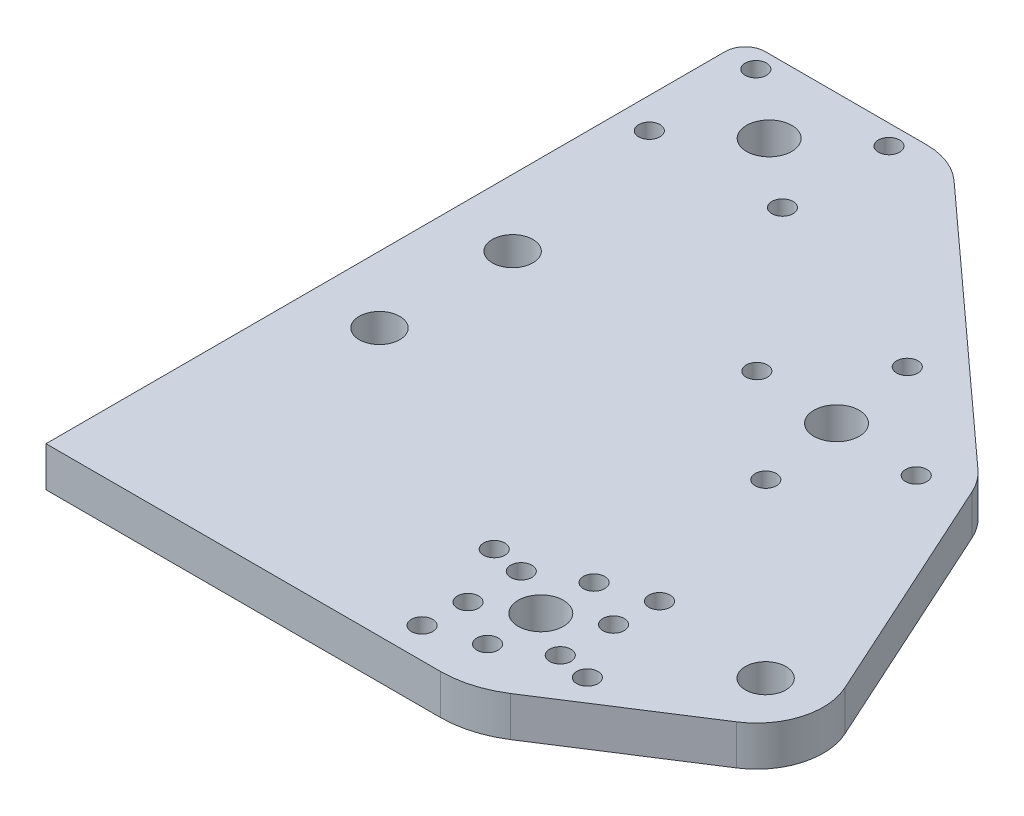
from build123d import *

# Parameters (mm, degrees)
ESBO_O1_R                = 1.6
ESBO_O1_R_2              = 3.05
ESBO_O1_R_3              = 3.4
RESSALTO_EXTRUS_O1_DEPTH = 6
ESBO_O2_R                = 3.05
CORTE_EXTRUS_O1_DEPTH    = 10


with BuildPart() as part:
    # Esboço1 → Ressalto-extrusão1 (new body)
    with BuildSketch(Plane.XZ.offset(6)):
        with BuildLine():
            Line((151.235707119, -14.290882553), (167.194797105, 20.786465148))
            ThreePointArc((167.194797105, 20.786465148), (167.685761246, 27.750971942), (163.500492529, 33.339256691))
            Line((163.500492529, 33.339256691), (142.828802448, 46.629356782))
            ThreePointArc((142.828802448, 46.629356782), (138.919887467, 48.41513057), (134.666145804, 49.026919929))
            Line((134.666145804, 49.026919929), (75.43742995, 49.026919929))
            Line((75.43742995, 49.026919929), (75.43742995, -53))
            ThreePointArc((75.43742995, -53), (76.316109606, -55.121320344), (78.43742995, -56))
            Line((78.43742995, -56), (102.684651367, -56))
            ThreePointArc((102.684651367, -56), (106.289825387, -55.327524875), (109.410121436, -53.400544058))
            Line((109.410121436, -53.400544058), (148.858963728, -17.550205761))
            ThreePointArc((148.858963728, -17.550205761), (150.213387743, -16.041631797), (151.235707119, -14.290882553))
        make_face()
        with Locations((119.376459837, -13.805034822)):
            Circle(ESBO_O1_R, mode=Mode.SUBTRACT)
        with Locations((146.515369336, 38.790557081)):
            Circle(ESBO_O1_R, mode=Mode.SUBTRACT)
        with Locations((142.006279058, 23.439071652)):
            Circle(ESBO_O1_R, mode=Mode.SUBTRACT)
        with Locations((159.995304814, 25.487659571)):
            Circle(ESBO_O1_R_2, mode=Mode.SUBTRACT)
        with Locations((100.03742995, -37)):
            Circle(ESBO_O1_R, mode=Mode.SUBTRACT)
        with Locations((100.03742995, -53)):
            Circle(ESBO_O1_R, mode=Mode.SUBTRACT)
        with Locations((80.03742995, -37)):
            Circle(ESBO_O1_R, mode=Mode.SUBTRACT)
        with Locations((80.03742995, -53)):
            Circle(ESBO_O1_R, mode=Mode.SUBTRACT)
        with Locations((122.816922272, 29.0754345)):
            Circle(ESBO_O1_R, mode=Mode.SUBTRACT)
        with Locations((127.326012551, 44.426919929)):
            Circle(ESBO_O1_R, mode=Mode.SUBTRACT)
        with Locations((130.137211947, -25.645905315)):
            Circle(ESBO_O1_R, mode=Mode.SUBTRACT)
        with Locations((144.938300063, -12.194965178)):
            Circle(ESBO_O1_R, mode=Mode.SUBTRACT)
        with Locations((134.177547953, -0.354094685)):
            Circle(ESBO_O1_R, mode=Mode.SUBTRACT)
        with Locations((141.594349035, 29.932995791)):
            Circle(ESBO_O1_R, mode=Mode.SUBTRACT)
        with Locations((134.666145804, 25.932995791)):
            Circle(ESBO_O1_R, mode=Mode.SUBTRACT)
        with Locations((127.737942574, 29.932995791)):
            Circle(ESBO_O1_R, mode=Mode.SUBTRACT)
        with Locations((127.737942574, 37.932995791)):
            Circle(ESBO_O1_R, mode=Mode.SUBTRACT)
        with Locations((134.666145804, 41.932995791)):
            Circle(ESBO_O1_R, mode=Mode.SUBTRACT)
        with Locations((141.594349035, 37.932995791)):
            Circle(ESBO_O1_R, mode=Mode.SUBTRACT)
        with Locations((134.666145804, 33.932995791)):
            Circle(ESBO_O1_R_3, mode=Mode.SUBTRACT)
        with Locations((132.15737995, -13)):
            Circle(ESBO_O1_R_3, mode=Mode.SUBTRACT)
        with Locations((90.03742995, -45)):
            Circle(ESBO_O1_R_3, mode=Mode.SUBTRACT)
    extrude(amount=-RESSALTO_EXTRUS_O1_DEPTH)

    # Esboço2 → Corte-extrusão1 (cut)
    with BuildSketch(Plane.XZ.offset(6)):
        with Locations((85.43742995, 8.932995791)):
            Circle(ESBO_O2_R)
        with Locations((85.43742995, -11.067004209)):
            Circle(ESBO_O2_R)
    extrude(amount=-CORTE_EXTRUS_O1_DEPTH, mode=Mode.SUBTRACT)


solid = part.part
